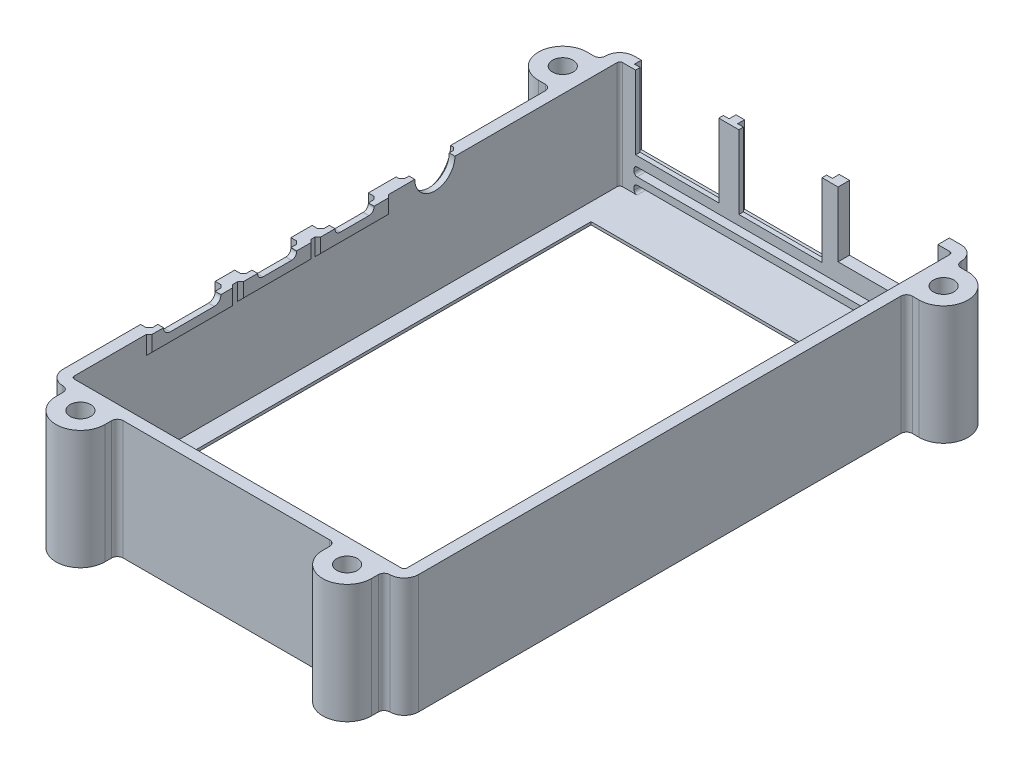
from build123d import *

# Parameters (mm, degrees)
BASE_DEPTH                      = 20.75
SHELL_T                         = -2
CLAMPS_DEPTH                    = 20.75
CLAMP_FILLETS_R                 = 1
SKETCH20_R                      = 1.8
CLAMP_HOLES_DEPTH               = 123.621878146
SKETCH21_R                      = 2.9
CLAMP_COUNTERSINKS_DEPTH        = 3.4
CLAMP_COUNTERSINK_CHAMFERS_SIZE = 0.3
SKETCH24_W                      = 14.5
SKETCH24_H                      = 12.8
USB_CUTOUT_DEPTH                = 18.25
SKETCH25_W                      = 16.5
SKETCH25_H                      = 13.5
USB_APPROACH_DEPTH              = 1.2
SKETCH28_W                      = 17.4
SKETCH28_H                      = 11.3
RJ45_CUTOUT_DEPTH               = 22.7
SKETCH29_W                      = 15
SKETCH29_H                      = 3.2
USB_C_SUPPORT_DEPTH             = 0.5
USB_C_SUPPORT_CHAMFER_SIZE      = 0.5
SKETCH30_W                      = 13
SKETCH30_H                      = 2.7
USB_C_APPROACH_DEPTH            = 1.5
USB_C_APPROACH_CHAMFER_SIZE     = 0.5
SKETCH36_W                      = 9.8
SKETCH36_H                      = 2.48
HDMI_APPROACH_DEPTH             = 1.5
HDMI_APPROACH_CHAMFER_SIZE      = 0.5
SKETCH37_W                      = 12.8
SKETCH37_H                      = 2.98
HDMI_SUPPORT_DEPTH              = 0.5
HDMI_SUPPORT_CHAMFER_SIZE       = 0.5
HDMI_CUTOUT_DEPTH               = 1
SKETCH32_R                      = 3.5
AUDIO_CUTOUT_DEPTH              = 2
SKETCH33_R                      = 4.75
AUDIO_APPROACH_DEPTH            = 1
AUDIO_APPROACH_CHAMFER_SIZE     = 0.5
AIR_SCOOP_REACH                 = 123.517
SKETCH41_W                      = 53
SKETCH41_H                      = 1.5
VENT_DEPTH                      = 2
VENT_FILLET_R                   = 0.5
SKETCH40_W                      = 52
SKETCH40_H                      = 78
SCREEN_CUTOUT_DEPTH             = 123.621878163
CHAMFER1_SIZE                   = 1.5


with BuildPart() as part:
    # Sketch2 → Base (new body)
    with BuildSketch(Plane(origin=(0, 0, 0), x_dir=(1, 0, 0), z_dir=(0, 1, 0))):
        with BuildLine():
            Line((2.5, 0), (59.5, 0))
            ThreePointArc((59.5, 0), (61.267766953, 0.732233047), (62, 2.5))
            Line((62, 2.5), (62, 97.1))
            ThreePointArc((62, 97.1), (61.267766953, 98.867766953), (59.5, 99.6))
            Line((59.5, 99.6), (2.5, 99.6))
            ThreePointArc((2.5, 99.6), (0.732233047, 98.867766953), (0, 97.1))
            Line((0, 97.1), (0, 2.5))
            ThreePointArc((0, 2.5), (0.732233047, 0.732233047), (2.5, 0))
        make_face()
    extrude(amount=BASE_DEPTH)

    # Shell
    shell_openings = [part.faces().sort_by_distance(p)[0] for p in [
        (31, 20.75, -49.8),
    ]]
    offset(amount=SHELL_T, openings=shell_openings, kind=Kind.INTERSECTION)

    # Sketch14 → Clamps (add)
    with BuildSketch(Plane.XZ):
        with BuildLine():
            Line((-2.2, -87.6), (0, -87.6))
            Line((0, -87.6), (0, -96.1))
            Line((0, -96.1), (-2.2, -96.1))
            ThreePointArc((-2.2, -96.1), (-6.45, -91.85), (-2.2, -87.6))
        make_face()
        with BuildLine():
            Line((3.5, 2.2), (3.5, 0))
            Line((3.5, 0), (12, 0))
            Line((12, 0), (12, 2.2))
            ThreePointArc((12, 2.2), (7.75, 6.45), (3.5, 2.2))
        make_face()
        with BuildLine():
            Line((64.2, -87.6), (62, -87.6))
            Line((62, -87.6), (62, -96.1))
            Line((62, -96.1), (64.2, -96.1))
            ThreePointArc((64.2, -96.1), (68.45, -91.85), (64.2, -87.6))
        make_face()
        with BuildLine():
            Line((50, 0), (50, 2.2))
            ThreePointArc((50, 2.2), (54.25, 6.45), (58.5, 2.2))
            Line((58.5, 2.2), (58.5, 0))
            Line((58.5, 0), (50, 0))
        make_face()
    extrude(amount=-CLAMPS_DEPTH)

    # Clamp Fillets
    clamp_fillets_edges = [part.edges().sort_by_distance(p)[0] for p in [
        (0, 10.375, -96.1),
        (0, 10.375, -87.6),
        (3.5, 10.375, 0),
        (12, 10.375, 0),
        (62, 10.375, -87.6),
        (62, 10.375, -96.1),
        (50, 10.375, 0),
        (58.5, 10.375, 0),
    ]]
    fillet(clamp_fillets_edges, radius=CLAMP_FILLETS_R - 0.0001)  # a hair under: the kernel refuses the full size

    # Sketch20 → Clamp Holes (cut, through all)
    with BuildSketch(Plane.XZ):
        with Locations(Location((7.75, 2.2, 0), (0, 0, 270))):
            Circle(SKETCH20_R)
        with Locations(Location((54.25, 2.2, 0), (0, 0, 270))):
            Circle(SKETCH20_R)
        with Locations(Location((64.2, -91.85, 0), (0, 0, 270))):
            Circle(SKETCH20_R)
        with Locations(Location((-2.2, -91.85, 0), (0, 0, 270))):
            Circle(SKETCH20_R)
    extrude(amount=-CLAMP_HOLES_DEPTH, mode=Mode.SUBTRACT)

    # Sketch21 → Clamp Countersinks (cut)
    with BuildSketch(Plane.XZ):
        with Locations(Location((7.75, 2.2, 0), (0, 0, 270))):
            Circle(SKETCH21_R)
        with Locations(Location((54.25, 2.2, 0), (0, 0, 270))):
            Circle(SKETCH21_R)
        with Locations(Location((64.2, -91.85, 0), (0, 0, 270))):
            Circle(SKETCH21_R)
        with Locations(Location((-2.2, -91.85, 0), (0, 0, 270))):
            Circle(SKETCH21_R)
    extrude(amount=-CLAMP_COUNTERSINKS_DEPTH, mode=Mode.SUBTRACT)

    # Clamp Countersink Chamfers
    clamp_countersink_chamfers_edges = [part.edges().sort_by_distance(p)[0] for p in [
        (-2.2, 0, -88.95),
        (64.2, 0, -88.95),
        (54.25, 0, 5.1),
        (7.75, 0, 5.1),
    ]]
    chamfer(clamp_countersink_chamfers_edges, length=CLAMP_COUNTERSINK_CHAMFERS_SIZE)

    # Sketch24 → USB Cutout (cut)
    with BuildSketch(Plane(origin=(0, 0, -99.6), x_dir=(-1, 0, 0), z_dir=(0, 0, -1))):
        with Locations((-30, 14.35)):
            Rectangle(SKETCH24_W, SKETCH24_H)
        with Locations((-12, 14.35)):
            Rectangle(SKETCH24_W, SKETCH24_H)
    extrude(amount=-USB_CUTOUT_DEPTH, mode=Mode.SUBTRACT)

    # Sketch25 → USB Approach (cut)
    with BuildSketch(Plane(origin=(0, 0, -99.6), x_dir=(-1, 0, 0), z_dir=(0, 0, -1))):
        with Locations((-30, 14)):
            Rectangle(SKETCH25_W, SKETCH25_H)
        with Locations((-12, 14)):
            Rectangle(SKETCH25_W, SKETCH25_H)
    extrude(amount=-USB_APPROACH_DEPTH, mode=Mode.SUBTRACT)

    # Sketch28 → RJ45 Cutout (cut)
    with BuildSketch(Plane(origin=(0, 0, -99.6), x_dir=(-1, 0, 0), z_dir=(0, 0, -1))):
        with Locations((-48.75, 15.1)):
            Rectangle(SKETCH28_W, SKETCH28_H)
    extrude(amount=-RJ45_CUTOUT_DEPTH, mode=Mode.SUBTRACT)

    # Sketch29 → USB-C Support (add)
    with BuildSketch(Plane(origin=(2, 0, 0), x_dir=(0, 0, -1), z_dir=(1, 0, 0))):
        with Locations((22.55, 19.15)):
            Rectangle(SKETCH29_W, SKETCH29_H)
    extrude(amount=USB_C_SUPPORT_DEPTH)

    # USB-C Support Chamfer
    usb_c_support_chamfer_edges = [part.edges().sort_by_distance(p)[0] for p in [
        (2.5, 19.15, -30.05),
        (2.5, 17.55, -22.55),
        (2.5, 19.15, -15.05),
    ]]
    chamfer(usb_c_support_chamfer_edges, length=USB_C_SUPPORT_CHAMFER_SIZE - 0.0001)  # a hair under: the kernel refuses the full size

    # Sketch30 → USB-C Approach (cut)
    with BuildSketch(Plane.ZY):
        with Locations((-22.55, 19.4)):
            Rectangle(SKETCH30_W, SKETCH30_H)
    extrude(amount=-USB_C_APPROACH_DEPTH, mode=Mode.SUBTRACT)

    # USB-C Approach Chamfer
    usb_c_approach_chamfer_edges = [part.edges().sort_by_distance(p)[0] for p in [
        (1.5, 19.4, -29.05),
        (1.5, 19.4, -16.05),
        (1.5, 18.05, -22.55),
    ]]
    chamfer(usb_c_approach_chamfer_edges, length=USB_C_APPROACH_CHAMFER_SIZE)

    # Sketch36 → HDMI Approach (cut)
    with BuildSketch(Plane.ZY):
        with Locations((-50.85, 19.51)):
            Rectangle(SKETCH36_W, SKETCH36_H)
        with Locations((-37.35, 19.51)):
            Rectangle(SKETCH36_W, SKETCH36_H)
    extrude(amount=-HDMI_APPROACH_DEPTH, mode=Mode.SUBTRACT)

    # HDMI Approach Chamfer
    hdmi_approach_chamfer_edges = [part.edges().sort_by_distance(p)[0] for p in [
        (1.5, 19.51, -55.75),
        (1.5, 19.51, -45.95),
        (1.5, 18.27, -50.85),
        (1.5, 19.51, -42.25),
        (1.5, 19.51, -32.45),
        (1.5, 18.27, -37.35),
    ]]
    chamfer(hdmi_approach_chamfer_edges, length=HDMI_APPROACH_CHAMFER_SIZE)

    # Sketch37 → HDMI Support (add)
    with BuildSketch(Plane(origin=(2, 0, 0), x_dir=(0, 0, -1), z_dir=(1, 0, 0))):
        with Locations((37.35, 19.26)):
            Rectangle(SKETCH37_W, SKETCH37_H)
        with Locations((50.85, 19.26)):
            Rectangle(SKETCH37_W, SKETCH37_H)
    extrude(amount=HDMI_SUPPORT_DEPTH)

    # HDMI Support Chamfer
    hdmi_support_chamfer_edges = [part.edges().sort_by_distance(p)[0] for p in [
        (2.5, 19.26, -57.25),
        (2.5, 17.77, -50.85),
        (2.5, 19.26, -44.45),
        (2.5, 19.26, -43.75),
        (2.5, 17.77, -37.35),
        (2.5, 19.26, -30.95),
    ]]
    chamfer(hdmi_support_chamfer_edges, length=HDMI_SUPPORT_CHAMFER_SIZE - 0.0001)  # a hair under: the kernel refuses the full size

    # Sketch38 → HDMI Cutout (cut)
    with BuildSketch(Plane.ZY.offset(-1.5)):
        with BuildLine():
            Line((-54.25, 20.75), (-47.45, 20.75))
            Line((-47.45, 20.75), (-47.45, 20.67))
            ThreePointArc((-47.45, 20.67), (-47.713603897, 20.033603897), (-48.35, 19.77))
            Line((-48.35, 19.77), (-53.35, 19.77))
            ThreePointArc((-53.35, 19.77), (-53.986396103, 20.033603897), (-54.25, 20.67))
            Line((-54.25, 20.67), (-54.25, 20.75))
        make_face()
        with BuildLine():
            Line((-40.75, 20.75), (-33.95, 20.75))
            Line((-33.95, 20.75), (-33.95, 20.67))
            ThreePointArc((-33.95, 20.67), (-34.213603897, 20.033603897), (-34.85, 19.77))
            Line((-34.85, 19.77), (-39.85, 19.77))
            ThreePointArc((-39.85, 19.77), (-40.486396103, 20.033603897), (-40.75, 20.67))
            Line((-40.75, 20.67), (-40.75, 20.75))
        make_face()
        with BuildLine():
            Line((-27.55, 20.75), (-17.55, 20.75))
            Line((-17.55, 20.75), (-17.55, 20.713167547))
            ThreePointArc((-17.55, 20.713167547), (-17.890683887, 19.890683887), (-18.713167547, 19.55))
            Line((-18.713167547, 19.55), (-26.386832453, 19.55))
            ThreePointArc((-26.386832453, 19.55), (-27.209316113, 19.890683887), (-27.55, 20.713167547))
            Line((-27.55, 20.713167547), (-27.55, 20.75))
        make_face()
    extrude(amount=-HDMI_CUTOUT_DEPTH, mode=Mode.SUBTRACT)

    # Sketch32 → Audio Cutout (cut)
    with BuildSketch(Plane.ZY):
        with Locations((-65.35, 20.75)):
            Circle(SKETCH32_R)
    extrude(amount=-AUDIO_CUTOUT_DEPTH, mode=Mode.SUBTRACT)

    # Sketch33 → Audio Approach (cut)
    with BuildSketch(Plane.ZY):
        with Locations((-65.35, 20.75)):
            Circle(SKETCH33_R)
    extrude(amount=-AUDIO_APPROACH_DEPTH, mode=Mode.SUBTRACT)

    # Audio Approach Chamfer
    audio_approach_chamfer_edges = [part.edges().sort_by_distance(p)[0] for p in [
        (1, 16, -65.35),
    ]]
    chamfer(audio_approach_chamfer_edges, length=AUDIO_APPROACH_CHAMFER_SIZE)

    # Air Scoop: up to this face of the body (flat: up to its plane)
    air_scoop_end = Plane(part.part.faces().sort_by_distance((2, 10.683962064, -50.685539842))[0])
    # Sketch39 → Air Scoop (add, up to the picked face)
    with BuildSketch(Plane.ZY.offset(-60), mode=Mode.PRIVATE) as air_scoop_sk1:
        with BuildLine():
            Line((-2, 2), (-10, 2))
            ThreePointArc((-10, 2), (-4.343145751, 4.343145751), (-2, 10))
            Line((-2, 10), (-2, 2))
        make_face()
    air_scoop_tool1 = split(extrude(air_scoop_sk1.sketch, amount=AIR_SCOOP_REACH, mode=Mode.PRIVATE), bisect_by=air_scoop_end, keep=Keep.BOTH, mode=Mode.PRIVATE)
    add(air_scoop_tool1.solids().sort_by(Axis((60, 3.786944, -3.786944), (-1, 0, 0)))[0])

    # Sketch41 → Vent (cut)
    with BuildSketch(Plane(origin=(0, 0, -99.6), x_dir=(-1, 0, 0), z_dir=(0, 0, -1))):
        with Locations((-31, 5.5)):
            Rectangle(SKETCH41_W, SKETCH41_H)
        with Locations((-31, 2.75)):
            Rectangle(SKETCH41_W, SKETCH41_H)
    extrude(amount=-VENT_DEPTH, mode=Mode.SUBTRACT)

    # Vent Fillet
    vent_fillet_edges = [part.edges().sort_by_distance(p)[0] for p in [
        (57.5, 4.75, -98.6),
        (57.5, 6.25, -98.6),
        (4.5, 6.25, -98.6),
        (4.5, 4.75, -98.6),
        (57.5, 2, -98.6),
        (57.5, 3.5, -98.6),
        (4.5, 3.5, -98.6),
        (4.5, 2, -98.6),
    ]]
    fillet(vent_fillet_edges, radius=VENT_FILLET_R)

    # Sketch40 → Screen Cutout (cut, through all)
    with BuildSketch(Plane.XZ):
        with Locations((31, -50.58226)):
            Rectangle(SKETCH40_W, SKETCH40_H)
    extrude(amount=-SCREEN_CUTOUT_DEPTH, mode=Mode.SUBTRACT)

    # Chamfer1
    chamfer1_edges = [part.edges().sort_by_distance(p)[0] for p in [
        (5, 0, -50.58226),
        (31, 0, -89.58226),
        (57, 0, -50.58226),
        (31, 0, -11.58226),
    ]]
    chamfer(chamfer1_edges, length=CHAMFER1_SIZE)


solid = part.part
